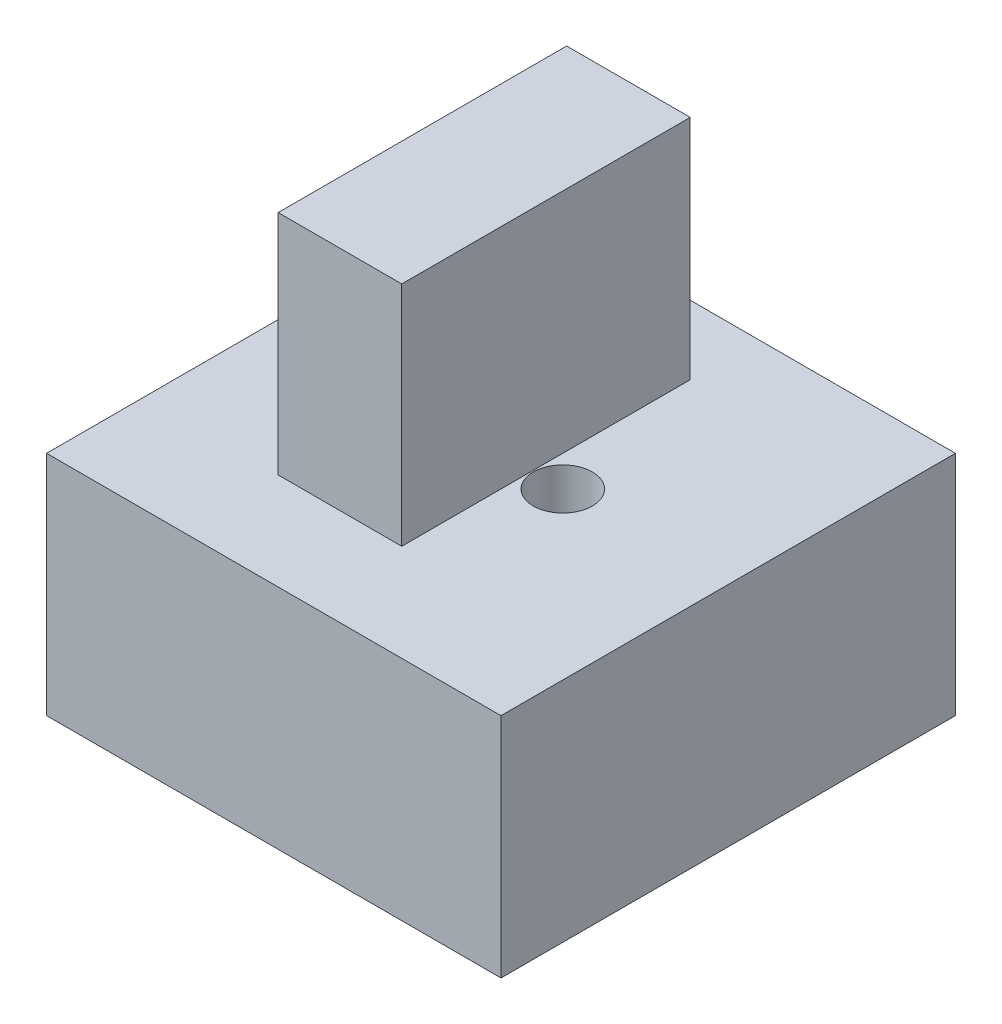
from build123d import *

# Parameters (mm, degrees)
SKETCH1_W           = 10
SKETCH1_H           = 10
SKETCH1_R           = 0.65
BOSS_EXTRUDE1_DEPTH = 5
SKETCH2_W           = 2.72
SKETCH2_H           = 6.349019662
BOSS_EXTRUDE2_DEPTH = 5


with BuildPart() as part:
    # Sketch1 → Boss-Extrude1 (new body)
    with BuildSketch(Plane(origin=(0, 0, 0), x_dir=(1, 0, 0), z_dir=(0, 1, 0))):
        Rectangle(SKETCH1_W, SKETCH1_H)
        Circle(SKETCH1_R, mode=Mode.SUBTRACT)
        with Locations((1.36, 0)):
            Circle(SKETCH1_R, mode=Mode.SUBTRACT)
        with Locations((-1.36, 0)):
            Circle(SKETCH1_R, mode=Mode.SUBTRACT)
        with Locations((-2.72, 0)):
            Circle(SKETCH1_R, mode=Mode.SUBTRACT)
    extrude(amount=BOSS_EXTRUDE1_DEPTH)

    # Sketch2 → Boss-Extrude2 (add)
    with BuildSketch(Plane(origin=(0, 5, 0), x_dir=(1, 0, 0), z_dir=(0, 1, 0))):
        with Locations((-0.68, 0.31018967)):
            Rectangle(SKETCH2_W, SKETCH2_H)
    extrude(amount=BOSS_EXTRUDE2_DEPTH)


solid = part.part
